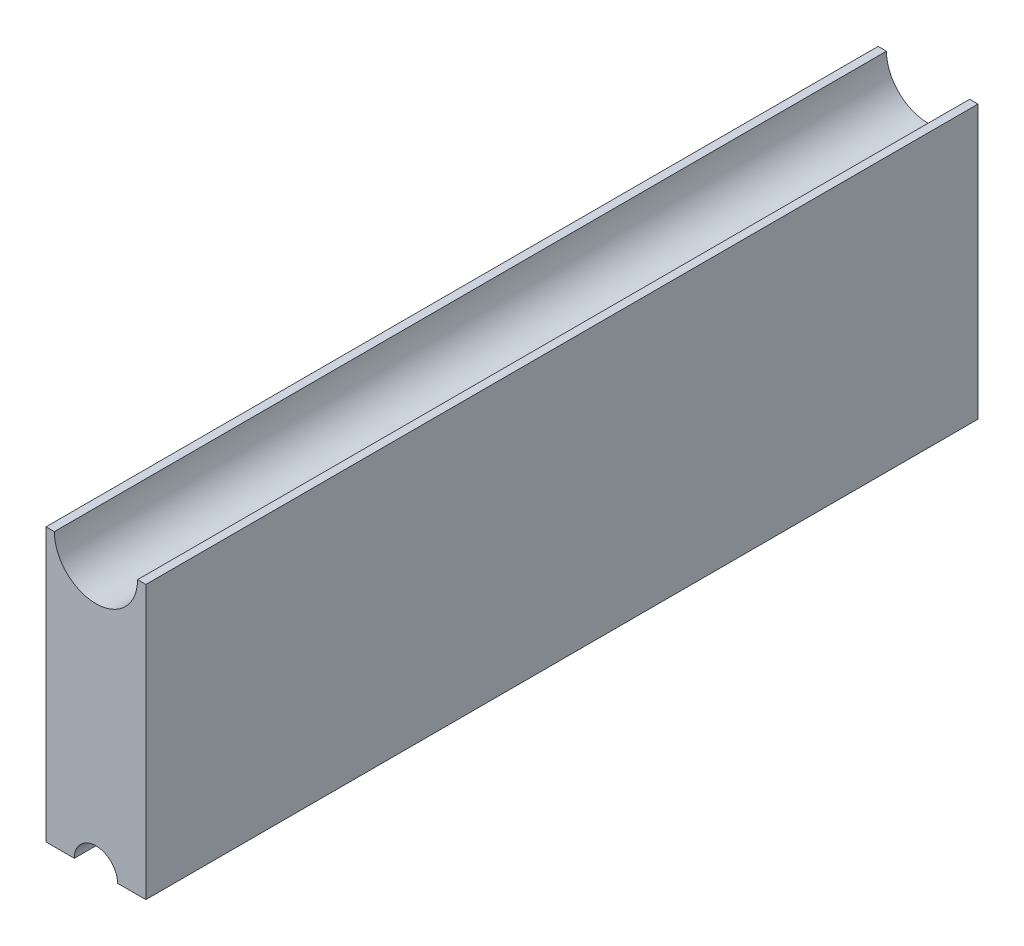
from build123d import *

# Parameters (mm, degrees)
BOSS_EXTRUDE4_DEPTH = 63.5


with BuildPart() as part:
    # Sketch1 → Boss-Extrude4 (new body)
    with BuildSketch(Plane.XY):
        with BuildLine():
            Line((-5.207, -29.21), (-5.207, -8.382))
            Line((-5.207, -8.382), (-5.842, -8.382))
            ThreePointArc((-5.842, -8.382), (-9.017, -11.557), (-12.192, -8.382))
            Line((-12.192, -8.382), (-12.827, -8.382))
            Line((-12.827, -8.382), (-12.827, -29.21))
            Line((-12.827, -29.21), (-10.668, -29.21))
            ThreePointArc((-10.668, -29.21), (-9.017, -27.559), (-7.366, -29.21))
            Line((-7.366, -29.21), (-5.207, -29.21))
        make_face()
    extrude(amount=BOSS_EXTRUDE4_DEPTH)


solid = part.part
